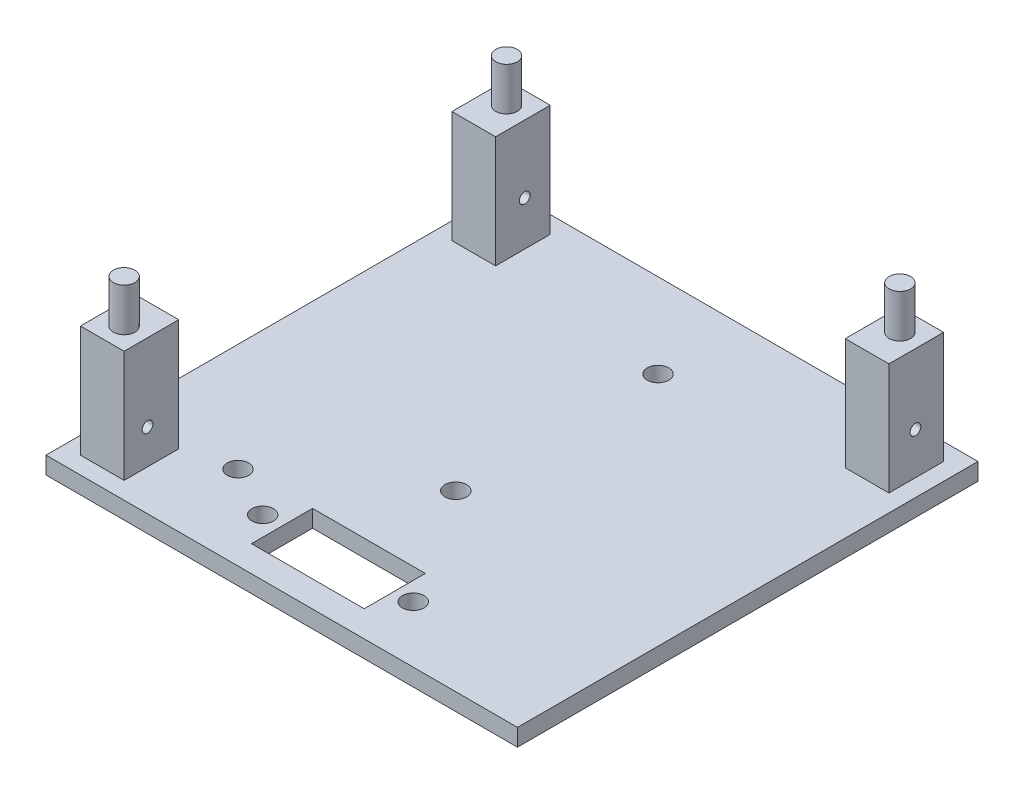
from build123d import *

# Parameters (mm, degrees)
SKETCH2_W           = 54.8
SKETCH2_H           = 53.53
BOSS_EXTRUDE1_DEPTH = 2
SKETCH3_W           = 5.08
SKETCH3_H           = 6.35
BOSS_EXTRUDE2_DEPTH = 13
SKETCH6_R           = 1.25
BOSS_EXTRUDE3_DEPTH = 5
CUT_EXTRUDE1_REACH  = 45.21
SKETCH7_W           = 13.1
SKETCH7_H           = 7.1
CUT_EXTRUDE2_REACH  = 45.21
SKETCH8_R           = 1.25
CUT_EXTRUDE4_REACH  = 64.484
SKETCH9_R           = 0.625
CUT_EXTRUDE5_REACH  = 64.484
SKETCH10_R          = 0.625
CUT_EXTRUDE6_REACH  = 64.484
SKETCH11_R          = 0.625
CUT_EXTRUDE7_REACH  = 44.322
SKETCH12_R          = 1.25
CUT_EXTRUDE8_REACH  = 44.322
SKETCH13_R          = 1.25


with BuildPart() as part:
    # Sketch2 → Boss-Extrude1 (new body)
    with BuildSketch(Plane(origin=(0, 0, 0), x_dir=(1, 0, 0), z_dir=(0, 1, 0))):
        Rectangle(SKETCH2_W, SKETCH2_H)
    extrude(amount=BOSS_EXTRUDE1_DEPTH)

    # Sketch3 → Boss-Extrude2 (add)
    with BuildSketch(Plane(origin=(0, 2, 0), x_dir=(1, 0, 0), z_dir=(0, 1, 0))):
        with Locations((-22.86, 21.59)):
            Rectangle(SKETCH3_W, SKETCH3_H)
        with Locations((22.86, 21.59)):
            Rectangle(SKETCH3_W, SKETCH3_H)
        with Locations((-22.86, -21.59)):
            Rectangle(SKETCH3_W, SKETCH3_H)
    extrude(amount=BOSS_EXTRUDE2_DEPTH)

    # Sketch6 → Boss-Extrude3 (add)
    with BuildSketch(Plane(origin=(0, 15, 0), x_dir=(1, 0, 0), z_dir=(0, 1, 0))):
        with Locations((-22.86, 22.225)):
            Circle(SKETCH6_R)
        with Locations((22.86, 22.225)):
            Circle(SKETCH6_R)
        with Locations((-22.86, -22.225)):
            Circle(SKETCH6_R)
    extrude(amount=BOSS_EXTRUDE3_DEPTH)

    # Sketch7 → Cut-Extrude1 (cut, up to next)
    with BuildSketch(Plane(origin=(0, 0, 0), x_dir=(-1, 0, 0), z_dir=(0, -1, 0)), mode=Mode.PRIVATE) as cut_extrude1_sk1:
        with Locations((0, -20.180596319)):
            Rectangle(SKETCH7_W, SKETCH7_H)
    cut_extrude1_tool1 = extrude(cut_extrude1_sk1.sketch, amount=-CUT_EXTRUDE1_REACH, mode=Mode.PRIVATE) & part.part
    add(cut_extrude1_tool1.solids().sort_by_distance((0, 0, 20.180596))[0], mode=Mode.SUBTRACT)

    # Sketch8 → Cut-Extrude2 (cut, up to next)
    with BuildSketch(Plane.XZ, mode=Mode.PRIVATE) as cut_extrude2_sk1:
        with Locations((0, 6.530805807)):
            Circle(SKETCH8_R)
    cut_extrude2_tool1 = extrude(cut_extrude2_sk1.sketch, amount=-CUT_EXTRUDE2_REACH, mode=Mode.PRIVATE) & part.part
    # Sketch8 → Cut-Extrude2 (cut, up to next)
    with BuildSketch(Plane.XZ, mode=Mode.PRIVATE) as cut_extrude2_sk2:
        with Locations((0, -16.969194193)):
            Circle(SKETCH8_R)
    cut_extrude2_tool2 = extrude(cut_extrude2_sk2.sketch, amount=-CUT_EXTRUDE2_REACH, mode=Mode.PRIVATE) & part.part
    add(cut_extrude2_tool1.solids().sort_by_distance((0, 0, 6.530806))[0], mode=Mode.SUBTRACT)
    add(cut_extrude2_tool2.solids().sort_by_distance((0, 0, -16.969194))[0], mode=Mode.SUBTRACT)

    # Sketch9 → Cut-Extrude4 (cut, up to next)
    with BuildSketch(Plane.ZY.offset(25.4), mode=Mode.PRIVATE) as cut_extrude4_sk1:
        with Locations((-21.804497524, 7.157449877)):
            Circle(SKETCH9_R)
    cut_extrude4_tool1 = extrude(cut_extrude4_sk1.sketch, amount=-CUT_EXTRUDE4_REACH, mode=Mode.PRIVATE) & part.part
    add(cut_extrude4_tool1.solids().sort_by_distance((-25.4, 7.15745, -21.804498))[0], mode=Mode.SUBTRACT)

    # Sketch10 → Cut-Extrude5 (cut, up to next)
    with BuildSketch(Plane(origin=(25.4, 0, 0), x_dir=(0, 0, -1), z_dir=(1, 0, 0)), mode=Mode.PRIVATE) as cut_extrude5_sk1:
        with Locations((21.493617153, 6.854012901)):
            Circle(SKETCH10_R)
    cut_extrude5_tool1 = extrude(cut_extrude5_sk1.sketch, amount=-CUT_EXTRUDE5_REACH, mode=Mode.PRIVATE) & part.part
    add(cut_extrude5_tool1.solids().sort_by_distance((25.4, 6.854013, -21.493617))[0], mode=Mode.SUBTRACT)

    # Sketch11 → Cut-Extrude6 (cut, up to next)
    with BuildSketch(Plane.ZY.offset(25.4), mode=Mode.PRIVATE) as cut_extrude6_sk1:
        with Locations((22.045503356, 6.022730906)):
            Circle(SKETCH11_R)
    cut_extrude6_tool1 = extrude(cut_extrude6_sk1.sketch, amount=-CUT_EXTRUDE6_REACH, mode=Mode.PRIVATE) & part.part
    add(cut_extrude6_tool1.solids().sort_by_distance((-25.4, 6.022731, 22.045503))[0], mode=Mode.SUBTRACT)

    # Sketch12 → Cut-Extrude7 (cut, up to next)
    with BuildSketch(Plane(origin=(0, 2, 0), x_dir=(1, 0, 0), z_dir=(0, 1, 0)), mode=Mode.PRIVATE) as cut_extrude7_sk1:
        with Locations((-14.835465402, -17.017151491)):
            Circle(SKETCH12_R)
    cut_extrude7_tool1 = extrude(cut_extrude7_sk1.sketch, amount=-CUT_EXTRUDE7_REACH, mode=Mode.PRIVATE) & part.part
    add(cut_extrude7_tool1.solids().sort_by_distance((-14.835465, 2, 17.017151))[0], mode=Mode.SUBTRACT)

    # Sketch13 → Cut-Extrude8 (cut, up to next)
    with BuildSketch(Plane(origin=(0, 2, 0), x_dir=(1, 0, 0), z_dir=(0, 1, 0)), mode=Mode.PRIVATE) as cut_extrude8_sk1:
        with Locations((-8.8, -20.180596319)):
            Circle(SKETCH13_R)
    cut_extrude8_tool1 = extrude(cut_extrude8_sk1.sketch, amount=-CUT_EXTRUDE8_REACH, mode=Mode.PRIVATE) & part.part
    # Sketch13 → Cut-Extrude8 (cut, up to next)
    with BuildSketch(Plane(origin=(0, 2, 0), x_dir=(1, 0, 0), z_dir=(0, 1, 0)), mode=Mode.PRIVATE) as cut_extrude8_sk2:
        with Locations((8.7, -20.180596319)):
            Circle(SKETCH13_R)
    cut_extrude8_tool2 = extrude(cut_extrude8_sk2.sketch, amount=-CUT_EXTRUDE8_REACH, mode=Mode.PRIVATE) & part.part
    add(cut_extrude8_tool1.solids().sort_by_distance((-8.8, 2, 20.180596))[0], mode=Mode.SUBTRACT)
    add(cut_extrude8_tool2.solids().sort_by_distance((8.7, 2, 20.180596))[0], mode=Mode.SUBTRACT)


solid = part.part
